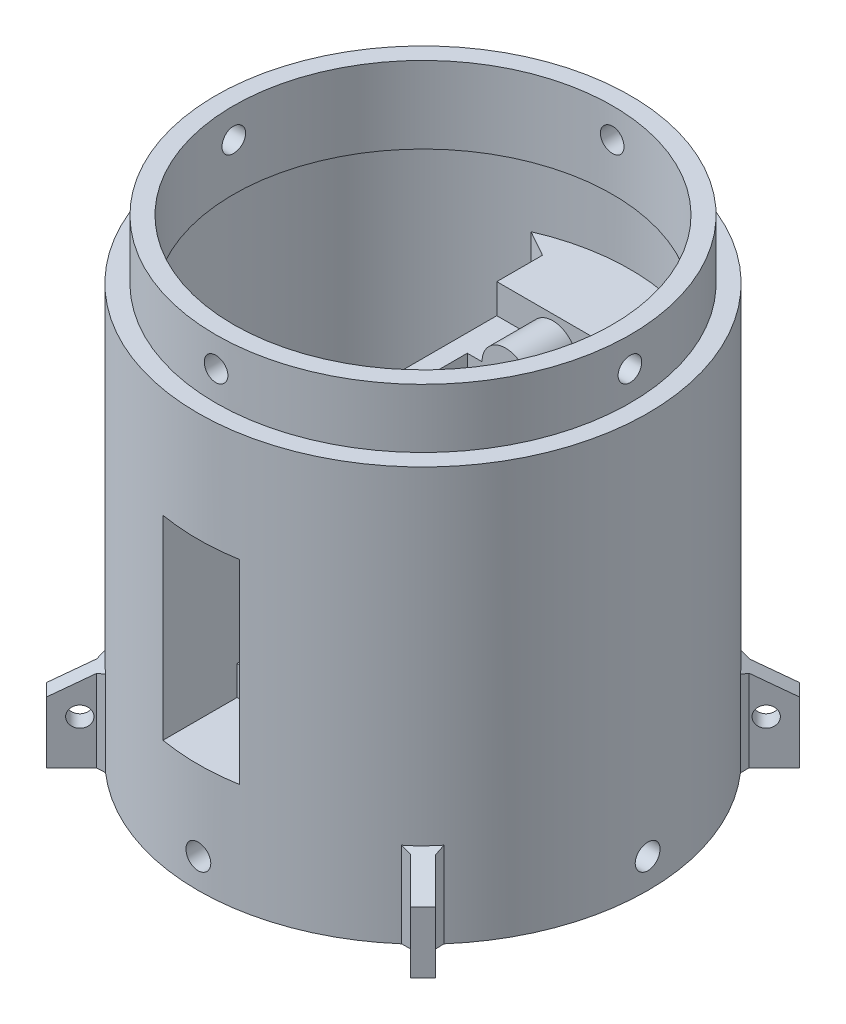
from build123d import *

# Parameters (mm, degrees)
SKETCH1_R           = 38.1
BOSS_EXTRUDE1_DEPTH = 35
SKETCH2_R           = 35.1
BOSS_EXTRUDE2_DEPTH = 10
SKETCH3_W           = 13
SKETCH3_H           = 23
CUT_EXTRUDE1_DEPTH  = 71.20128204
CUT_EXTRUDE2_START  = 25
SKETCH4_W           = 13
SKETCH4_H           = 33
CUT_EXTRUDE2_DEPTH  = 20
SKETCH5_R           = 1
CUT_EXTRUDE3_DEPTH  = 8
SHELL1_START        = -22
SHELL1_DEPTH        = 44
SHELL1_START_2      = -14
SHELL1_2_DEPTH      = 28
SHELL1_START_3      = -35
SHELL1_3_DEPTH      = 67
SHELL1_START_4      = 19.5
SHELL1_4_OUTLINE_R  = 32.1
SHELL1_4_DEPTH      = 25.5
SHELL1_5_DEPTH      = 15.5
SHELL1_6_DEPTH      = 12.5
SKETCH7_W           = 19
SKETCH7_H           = 44
BOSS_EXTRUDE3_DEPTH = 5
BOSS_EXTRUDE4_START = 15.5
BOSS_EXTRUDE4_DEPTH = 15.5
SKETCH9_R           = 2
CUT_EXTRUDE5_DEPTH  = 71.20128204
CIRPATTERN1_COUNT   = 2
CIRPATTERN1_ANGLE   = 90
BOSS_EXTRUDE5_DEPTH = 10
SKETCH11_W          = 13
SKETCH11_H          = 28
CUT_EXTRUDE6_DEPTH  = 10
CHAMFER1_SIZE       = 4.054059736
CHAMFER1_SIZE_2     = 5
SKETCH12_R          = 2.55
CUT_EXTRUDE7_DEPTH  = 15
SKETCH14_R          = 2.1
CUT_EXTRUDE8_DEPTH  = 6
CIRPATTERN2_COUNT   = 4
SKETCH15_R          = 1.7
BOSS_EXTRUDE6_DEPTH = 1.5
CIRPATTERN4_COUNT   = 4
CHAMFER2_SIZE       = 1.041824439
CHAMFER2_SIZE_2     = 1


with BuildPart() as part:
    # Sketch1 → Boss-Extrude1 (new, symmetric)
    with BuildSketch(Plane(origin=(0, 0, 0), x_dir=(1, 0, 0), z_dir=(0, 1, 0))):
        with Locations(Location((0, 0, 0), (0, 0, 270))):
            Circle(SKETCH1_R)
    extrude(amount=BOSS_EXTRUDE1_DEPTH, both=True)

    # Sketch2 → Boss-Extrude2 (add)
    with BuildSketch(Plane(origin=(0, 35, 0), x_dir=(1, 0, 0), z_dir=(0, 1, 0))):
        with Locations(Location((0, 0, 0), (0, 0, 270))):
            Circle(SKETCH2_R)
    extrude(amount=BOSS_EXTRUDE2_DEPTH)

    # Sketch3 → Cut-Extrude1 (cut, through all)
    with BuildSketch(Plane.XY):
        Rectangle(SKETCH3_W, SKETCH3_H)
    cut_extrude1 = extrude(amount=CUT_EXTRUDE1_DEPTH, mode=Mode.SUBTRACT)

    # Sketch4 → Cut-Extrude2 (cut)
    with BuildSketch(Plane.XY.offset(CUT_EXTRUDE2_START)):
        Rectangle(SKETCH4_W, SKETCH4_H)
    cut_extrude2 = extrude(amount=CUT_EXTRUDE2_DEPTH, mode=Mode.SUBTRACT)

    # Sketch5 → Cut-Extrude3 (cut)
    with BuildSketch(Plane.XY.offset(25)):
        with Locations((0, 14.5)):
            Circle(SKETCH5_R)
        with Locations((0, -14.5)):
            Circle(SKETCH5_R)
    cut_extrude3 = extrude(amount=-CUT_EXTRUDE3_DEPTH, mode=Mode.SUBTRACT)

    # Mirror1: Cut-Extrude1, Cut-Extrude2, Cut-Extrude3 across plane
    add(cut_extrude1.mirror(Plane.XY), mode=Mode.SUBTRACT)
    add(cut_extrude2.mirror(Plane.XY), mode=Mode.SUBTRACT)
    add(cut_extrude3.mirror(Plane.XY), mode=Mode.SUBTRACT)

    # Shell1: read off the stored shape, not the designer's step
    # Shell1 outline → Shell1 (cut)
    with BuildSketch(Plane.XY.offset(SHELL1_START)):
        with BuildLine():
            Line((-9.5, 19.5), (-9.5, 14.5))
            Line((-9.5, 14.5), (-4, 14.5))
            ThreePointArc((-4, 14.5), (0, 18.5), (4, 14.5))
            Line((4, 14.5), (9.5, 14.5))
            Line((9.5, 14.5), (9.5, 19.5))
            Line((9.5, 19.5), (-9.5, 19.5))
        make_face()
        with BuildLine():
            Line((-4, -14.5), (-9.5, -14.5))
            Line((-9.5, -14.5), (-9.5, -19.5))
            Line((-9.5, -19.5), (9.5, -19.5))
            Line((9.5, -19.5), (9.5, -14.5))
            Line((9.5, -14.5), (4, -14.5))
            ThreePointArc((4, -14.5), (0, -18.5), (-4, -14.5))
        make_face()
    extrude(amount=SHELL1_DEPTH, mode=Mode.SUBTRACT)

    # Shell1 2 outline → Shell1 2 (cut)
    with BuildSketch(Plane.XY.offset(SHELL1_START_2)):
        with BuildLine():
            ThreePointArc((4, 14.5), (0, 18.5), (-4, 14.5))
            Line((-4, 14.5), (4, 14.5))
        make_face()
        with BuildLine():
            Line((4, -14.5), (-4, -14.5))
            ThreePointArc((-4, -14.5), (0, -18.5), (4, -14.5))
        make_face()
    extrude(amount=SHELL1_2_DEPTH, mode=Mode.SUBTRACT)

    # Shell1 3 outline → Shell1 3 (cut)
    with BuildSketch(Plane(origin=(0, 0, 0), x_dir=(1, 0, 0), z_dir=(0, 1, 0)).offset(SHELL1_START_3)):
        with BuildLine():
            ThreePointArc((9.5, -33.789939331), (35.1, 0), (9.5, 33.789939331))
            Line((9.5, 33.789939331), (9.5, -33.789939331))
        make_face()
        with BuildLine():
            ThreePointArc((-9.5, 33.789939331), (-35.1, 0), (-9.5, -33.789939331))
            Line((-9.5, -33.789939331), (-9.5, 33.789939331))
        make_face()
    extrude(amount=SHELL1_3_DEPTH, mode=Mode.SUBTRACT)

    # Shell1 4 outline → Shell1 4 (cut)
    with BuildSketch(Plane(origin=(0, 0, 0), x_dir=(1, 0, 0), z_dir=(0, 1, 0)).offset(SHELL1_START_4)):
        Circle(SHELL1_4_OUTLINE_R)
    extrude(amount=SHELL1_4_DEPTH, mode=Mode.SUBTRACT)

    # Shell1 5 outline → Shell1 5 (cut)
    with BuildSketch(Plane(origin=(0, 0, 0), x_dir=(1, 0, 0), z_dir=(0, 1, 0)).offset(SHELL1_START_3)):
        with BuildLine():
            ThreePointArc((9.5, 33.789939331), (0, 35.1), (-9.5, 33.789939331))
            Line((-9.5, 33.789939331), (-9.5, -33.789939331))
            ThreePointArc((-9.5, -33.789939331), (0, -35.1), (9.5, -33.789939331))
            Line((9.5, -33.789939331), (9.5, 33.789939331))
        make_face()
    extrude(amount=SHELL1_5_DEPTH, mode=Mode.SUBTRACT)

    # Shell1 6 outline → Shell1 6 (cut)
    with BuildSketch(Plane(origin=(0, 0, 0), x_dir=(1, 0, 0), z_dir=(0, 1, 0)).offset(SHELL1_START_4)):
        with BuildLine():
            Line((9.5, 30.662028635), (9.5, 33.789939331))
            ThreePointArc((9.5, 33.789939331), (0, 35.1), (-9.5, 33.789939331))
            Line((-9.5, 33.789939331), (-9.5, 30.662028635))
            ThreePointArc((-9.5, 30.662028635), (0, 32.1), (9.5, 30.662028635))
        make_face()
        with BuildLine():
            ThreePointArc((-9.5, -33.789939331), (0, -35.1), (9.5, -33.789939331))
            Line((9.5, -33.789939331), (9.5, -30.662028635))
            ThreePointArc((9.5, -30.662028635), (0, -32.1), (-9.5, -30.662028635))
            Line((-9.5, -30.662028635), (-9.5, -33.789939331))
        make_face()
    extrude(amount=SHELL1_6_DEPTH, mode=Mode.SUBTRACT)

    # Sketch7 → Boss-Extrude3 (add)
    with BuildSketch(Plane.XZ.offset(14.5)):
        Rectangle(SKETCH7_W, SKETCH7_H)
    extrude(amount=BOSS_EXTRUDE3_DEPTH)

    # Sketch8 → Boss-Extrude4 (add)
    with BuildSketch(Plane.XZ.offset(19.5).offset(BOSS_EXTRUDE4_START)):
        with BuildLine():
            Line((9.5, -33.789939331), (9.5, 33.789939331))
            ThreePointArc((9.5, 33.789939331), (0, 35.1), (-9.5, 33.789939331))
            Line((-9.5, 33.789939331), (-9.5, -33.789939331))
            ThreePointArc((-9.5, -33.789939331), (0, -35.1), (9.5, -33.789939331))
        make_face()
    extrude(amount=-BOSS_EXTRUDE4_DEPTH)

    # Sketch9 → Cut-Extrude5 (cut, symmetric)
    with BuildSketch(Plane.XY):
        with Locations((0, 40)):
            Circle(SKETCH9_R)
    cut_extrude5 = extrude(amount=CUT_EXTRUDE5_DEPTH, both=True, mode=Mode.SUBTRACT)

    # CirPattern1: Cut-Extrude5 ×2 about axis
    cirpattern1_axis = Axis((0, 45, 0), (0, -1, 0))
    for i in range(1, CIRPATTERN1_COUNT):
        add(cut_extrude5.rotate(cirpattern1_axis, i * CIRPATTERN1_ANGLE / (CIRPATTERN1_COUNT - 1)), mode=Mode.SUBTRACT)

    # Sketch10 → Boss-Extrude5 (add)
    with BuildSketch(Plane.XZ.offset(35)):
        with BuildLine():
            Line((-27.1, 6), (-27.1, -6))
            Line((-27.1, -6), (-33.700938133, -9.811053408))
            ThreePointArc((-33.700938133, -9.811053408), (-35.1, 0), (-33.700938133, 9.811053408))
            Line((-33.700938133, 9.811053408), (-27.1, 6))
        make_face()
    boss_extrude5 = extrude(amount=-BOSS_EXTRUDE5_DEPTH)

    # Mirror2: Boss-Extrude5 across plane
    add(boss_extrude5.mirror(Plane(origin=(0, 0, 0), x_dir=(0, 0, 1), z_dir=(1, 0, 0))))

    # Sketch11 → Cut-Extrude6 (cut)
    with BuildSketch(Plane(origin=(0, 14.5, 0), x_dir=(1, 0, 0), z_dir=(0, 1, 0))):
        Rectangle(SKETCH11_W, SKETCH11_H)
    extrude(amount=-CUT_EXTRUDE6_DEPTH, mode=Mode.SUBTRACT)

    # Chamfer1
    # the kernel refuses this chamfer: 5, 4.054059736 mm, written as the material it adds along each edge
    with BuildSketch(Plane(origin=(9.5, 19.5, -33.789939331), x_dir=(0.9424129956636331, -3.3323496350141444e-13, 0.33445140993019723), z_dir=(0, -1, 0)), Plane(origin=(-9.5, -35, -33.789939331), x_dir=(-0.942412995663633, -3.3326568023114707e-13, 0.33445140993019795), z_dir=(0, 1, 0))) as chamfer1_piece_1:
        with BuildLine():
            Line((4.696338784, 0), (CHAMFER1_SIZE * 0.3344514099, CHAMFER1_SIZE * 0.942412995579))
            Line((CHAMFER1_SIZE * 0.3344514099, CHAMFER1_SIZE * 0.942412995579), (0, 0))
            ThreePointArc((0, 0), (2.413997324, -0.078571929), (4.696338784, 0))
        make_face()
    extrude(amount=54.5)
    with BuildSketch(Plane(origin=(9.5, -35, 33.789939331), x_dir=(0.9459849183546855, -3.230303762800237e-13, -0.3242106325299638), z_dir=(0, 1, 0)), Plane(origin=(-9.5, 19.5, 33.789939331), x_dir=(-0.9459849183546858, -3.230920425838641e-13, -0.3242106325299624), z_dir=(0, -1, 0))) as chamfer1_piece_2:
        with BuildLine():
            Line((3.936401758, 0), (CHAMFER1_SIZE_2 * 0.32421063253, CHAMFER1_SIZE_2 * 0.945984918355))
            Line((CHAMFER1_SIZE_2 * 0.32421063253, CHAMFER1_SIZE_2 * 0.945984918355), (0, 0))
            ThreePointArc((0, 0), (2.012123641, -0.05519851), (3.936401758, 0))
        make_face()
    extrude(amount=54.5)

    # Sketch12 → Cut-Extrude7 (cut)
    with BuildSketch(Plane.XZ.offset(35)):
        with Locations(Location((-32, 0, 0), (0, 0, 270))):
            Circle(SKETCH12_R)
    cut_extrude7 = extrude(amount=-CUT_EXTRUDE7_DEPTH, mode=Mode.SUBTRACT)

    # Sketch14 → Cut-Extrude8 (cut)
    with BuildSketch(Plane.ZY.offset(38.1)):
        with Locations((0, -30)):
            Circle(SKETCH14_R)
    cut_extrude8 = extrude(amount=-CUT_EXTRUDE8_DEPTH, mode=Mode.SUBTRACT)

    # CirPattern2: Cut-Extrude7, Cut-Extrude8 ×4 about axis
    cirpattern2_axis = Axis((0, 0, 0), (0, 1, 0))
    add([cut_extrude7.rotate(cirpattern2_axis, i * 360 / CIRPATTERN2_COUNT) for i in range(1, CIRPATTERN2_COUNT)], mode=Mode.SUBTRACT)
    add([cut_extrude8.rotate(cirpattern2_axis, i * 360 / CIRPATTERN2_COUNT) for i in range(1, CIRPATTERN2_COUNT)], mode=Mode.SUBTRACT)

    # Sketch15 → Boss-Extrude6 (add, symmetric)
    with BuildSketch(Plane(origin=(0, 0, 0), x_dir=(0.7071067811865477, 0, 0.7071067811865475), z_dir=(-0.7071067811865475, 0, 0.7071067811865477))):
        Polygon((-37.1, -20), (-37.1, -35), (-45.1, -35), (-45.1, -24.618802154), align=None)
        with Locations((-41.1, -27.5)):
            Circle(SKETCH15_R, mode=Mode.SUBTRACT)
    boss_extrude6 = extrude(amount=BOSS_EXTRUDE6_DEPTH, both=True)

    # CirPattern4: Boss-Extrude6 ×4 about axis
    cirpattern4_axis = Axis((0, 0, 0), (0, 1, 0))
    for i in range(1, CIRPATTERN4_COUNT):
        add(boss_extrude6.rotate(cirpattern4_axis, i * 360 / CIRPATTERN4_COUNT))

    # Chamfer2
    # the kernel refuses this chamfer: 1.041824439, 1 mm, written as the material it adds along each edge
    with BuildSketch(Plane(origin=(-27.980541301, -35, -25.859220957), x_dir=(-0.6688911032420826, 0, 0.743360405189562), z_dir=(0, 1, 0))) as chamfer2_piece_1_section:
        with BuildLine():
            Line((1.013571657, 0), (-CHAMFER2_SIZE * 0.0526577483904, -CHAMFER2_SIZE * 0.998612618222))
            Line((-CHAMFER2_SIZE * 0.0526577483904, -CHAMFER2_SIZE * 0.998612618222), (0, 0))
            ThreePointArc((0, 0), (0.521721145, -0.003367719), (1.013571657, 0))
        make_face()
    chamfer2_piece_1 = extrude(amount=17.121708801, mode=Mode.PRIVATE)
    chamfer2_piece_1 = split(chamfer2_piece_1, bisect_by=Plane(origin=(-32.401779682, -24.170221935, -30.280459338), z_dir=(0.35355339059327695, -0.8660254037844362, 0.35355339059327684)), keep=Keep.TOP, mode=Mode.PRIVATE)
    add(chamfer2_piece_1)
    with BuildSketch(Plane(origin=(25.859220957, -35, -27.980541301), x_dir=(-0.7433604051895665, 0, -0.6688911032420775), z_dir=(0, 1, 0))) as chamfer2_piece_2_section:
        with BuildLine():
            Line((1.013571657, 0), (-CHAMFER2_SIZE * 0.0526577483904, -CHAMFER2_SIZE * 0.998612618222))
            Line((-CHAMFER2_SIZE * 0.0526577483904, -CHAMFER2_SIZE * 0.998612618222), (0, 0))
            ThreePointArc((0, 0), (0.521721145, -0.003367719), (1.013571657, 0))
        make_face()
    chamfer2_piece_2 = extrude(amount=17.121708801, mode=Mode.PRIVATE)
    chamfer2_piece_2 = split(chamfer2_piece_2, bisect_by=Plane(origin=(30.280459338, -24.170221935, -32.401779682), z_dir=(-0.35355339059327684, -0.8660254037844362, 0.35355339059327684)), keep=Keep.TOP, mode=Mode.PRIVATE)
    add(chamfer2_piece_2)
    with BuildSketch(Plane(origin=(27.980541301, -35, 25.859220957), x_dir=(0.6688911032420789, 0, -0.743360405189565), z_dir=(0, 1, 0))) as chamfer2_piece_3_section:
        with BuildLine():
            Line((1.013571657, 0), (-CHAMFER2_SIZE * 0.0526577483904, -CHAMFER2_SIZE * 0.998612618222))
            Line((-CHAMFER2_SIZE * 0.0526577483904, -CHAMFER2_SIZE * 0.998612618222), (0, 0))
            ThreePointArc((0, 0), (0.521721145, -0.003367719), (1.013571657, 0))
        make_face()
    chamfer2_piece_3 = extrude(amount=17.121708801, mode=Mode.PRIVATE)
    chamfer2_piece_3 = split(chamfer2_piece_3, bisect_by=Plane(origin=(32.401779682, -24.170221935, 30.280459338), z_dir=(-0.35355339059327684, -0.8660254037844362, -0.35355339059327684)), keep=Keep.TOP, mode=Mode.PRIVATE)
    add(chamfer2_piece_3)
    with BuildSketch(Plane(origin=(-25.859220957, -35, 27.980541301), x_dir=(0.7433604051895649, 0, 0.6688911032420792), z_dir=(0, 1, 0))) as chamfer2_piece_4_section:
        with BuildLine():
            Line((1.013571657, 0), (-CHAMFER2_SIZE * 0.0526577483904, -CHAMFER2_SIZE * 0.998612618222))
            Line((-CHAMFER2_SIZE * 0.0526577483904, -CHAMFER2_SIZE * 0.998612618222), (0, 0))
            ThreePointArc((0, 0), (0.521721145, -0.003367719), (1.013571657, 0))
        make_face()
    chamfer2_piece_4 = extrude(amount=17.121708801, mode=Mode.PRIVATE)
    chamfer2_piece_4 = split(chamfer2_piece_4, bisect_by=Plane(origin=(-30.280459338, -24.170221935, 32.401779682), z_dir=(0.35355339059327684, -0.8660254037844362, -0.35355339059327684)), keep=Keep.TOP, mode=Mode.PRIVATE)
    add(chamfer2_piece_4)
    with BuildSketch(Plane(origin=(-25.859220957, -35, -27.980541301), x_dir=(0.7437486943406798, 0, -0.6684593328442159), z_dir=(0, 1, 0))) as chamfer2_piece_5_section:
        with BuildLine():
            Line((1.057815706, 0), (-CHAMFER2_SIZE_2 * 0.0532376180654, CHAMFER2_SIZE_2 * 0.998581872469))
            Line((-CHAMFER2_SIZE_2 * 0.0532376180654, CHAMFER2_SIZE_2 * 0.998581872469), (0, 0))
            ThreePointArc((0, 0), (0.544412125, 0.003668197), (1.057815706, 0))
        make_face()
    chamfer2_piece_5 = extrude(amount=17.162619638, mode=Mode.PRIVATE)
    chamfer2_piece_5 = split(chamfer2_piece_5, bisect_by=Plane(origin=(-30.280459338, -24.170221935, -32.401779682), z_dir=(0.35355339059327695, -0.8660254037844362, 0.35355339059327684)), keep=Keep.TOP, mode=Mode.PRIVATE)
    add(chamfer2_piece_5)
    with BuildSketch(Plane(origin=(27.980541301, -35, -25.859220957), x_dir=(0.6684593328442138, 0, 0.7437486943406816), z_dir=(0, 1, 0))) as chamfer2_piece_6_section:
        with BuildLine():
            Line((1.057815706, 0), (-CHAMFER2_SIZE_2 * 0.0532376180654, CHAMFER2_SIZE_2 * 0.998581872469))
            Line((-CHAMFER2_SIZE_2 * 0.0532376180654, CHAMFER2_SIZE_2 * 0.998581872469), (0, 0))
            ThreePointArc((0, 0), (0.544412125, 0.003668197), (1.057815706, 0))
        make_face()
    chamfer2_piece_6 = extrude(amount=17.162619638, mode=Mode.PRIVATE)
    chamfer2_piece_6 = split(chamfer2_piece_6, bisect_by=Plane(origin=(32.401779682, -24.170221935, -30.280459338), z_dir=(-0.35355339059327684, -0.8660254037844362, 0.35355339059327684)), keep=Keep.TOP, mode=Mode.PRIVATE)
    add(chamfer2_piece_6)
    with BuildSketch(Plane(origin=(25.859220957, -35, 27.980541301), x_dir=(-0.7437486943406829, 0, 0.6684593328442123), z_dir=(0, 1, 0))) as chamfer2_piece_7_section:
        with BuildLine():
            Line((1.057815706, 0), (-CHAMFER2_SIZE_2 * 0.0532376180654, CHAMFER2_SIZE_2 * 0.998581872469))
            Line((-CHAMFER2_SIZE_2 * 0.0532376180654, CHAMFER2_SIZE_2 * 0.998581872469), (0, 0))
            ThreePointArc((0, 0), (0.544412125, 0.003668197), (1.057815706, 0))
        make_face()
    chamfer2_piece_7 = extrude(amount=17.162619638, mode=Mode.PRIVATE)
    chamfer2_piece_7 = split(chamfer2_piece_7, bisect_by=Plane(origin=(30.280459338, -24.170221935, 32.401779682), z_dir=(-0.35355339059327684, -0.8660254037844362, -0.35355339059327684)), keep=Keep.TOP, mode=Mode.PRIVATE)
    add(chamfer2_piece_7)
    with BuildSketch(Plane(origin=(-27.980541301, -35, 25.859220957), x_dir=(-0.6684593328442145, 0, -0.7437486943406809), z_dir=(0, 1, 0))) as chamfer2_piece_8_section:
        with BuildLine():
            Line((1.057815706, 0), (-CHAMFER2_SIZE_2 * 0.0532376180654, CHAMFER2_SIZE_2 * 0.998581872469))
            Line((-CHAMFER2_SIZE_2 * 0.0532376180654, CHAMFER2_SIZE_2 * 0.998581872469), (0, 0))
            ThreePointArc((0, 0), (0.544412125, 0.003668197), (1.057815706, 0))
        make_face()
    chamfer2_piece_8 = extrude(amount=17.162619638, mode=Mode.PRIVATE)
    chamfer2_piece_8 = split(chamfer2_piece_8, bisect_by=Plane(origin=(-32.401779682, -24.170221935, 30.280459338), z_dir=(0.35355339059327684, -0.8660254037844362, -0.35355339059327684)), keep=Keep.TOP, mode=Mode.PRIVATE)
    add(chamfer2_piece_8)


solid = part.part
